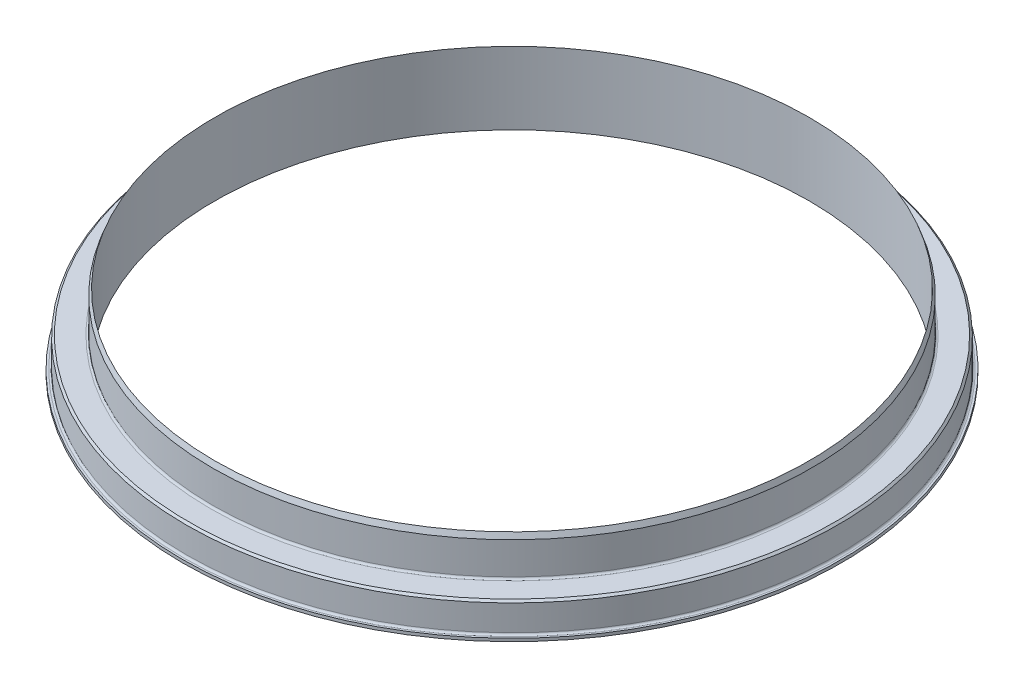
from build123d import *

# Parameters (mm, degrees)
FILLET1_R     = 0.508
CHAMFER1_SIZE = 0.508


with BuildPart() as part:
    # Sketch1 → Revolve1 (revolve)
    with BuildSketch(Plane.XY):
        Polygon((76.2, 18.542), (76.2, 0), (84.455, 0), (84.455, 0.762), (83.439, 0.762), (83.439, 8.382), (76.708, 8.382), (76.708, 17.146281471), align=None)
    revolve(axis=Axis((0, 28.738956579, 0), (0, -1, 0)))

    # Fillet1
    fillet1_edges = [part.edges().sort_by_distance(p)[0] for p in [
        (-76.708, 8.382, 0),
        (-83.439, 0.762, 0),
    ]]
    fillet(fillet1_edges, radius=FILLET1_R)

    # Chamfer1
    chamfer1_edges = [part.edges().sort_by_distance(p)[0] for p in [
        (-83.439, 8.382, 0),
    ]]
    chamfer(chamfer1_edges, length=CHAMFER1_SIZE)


solid = part.part
